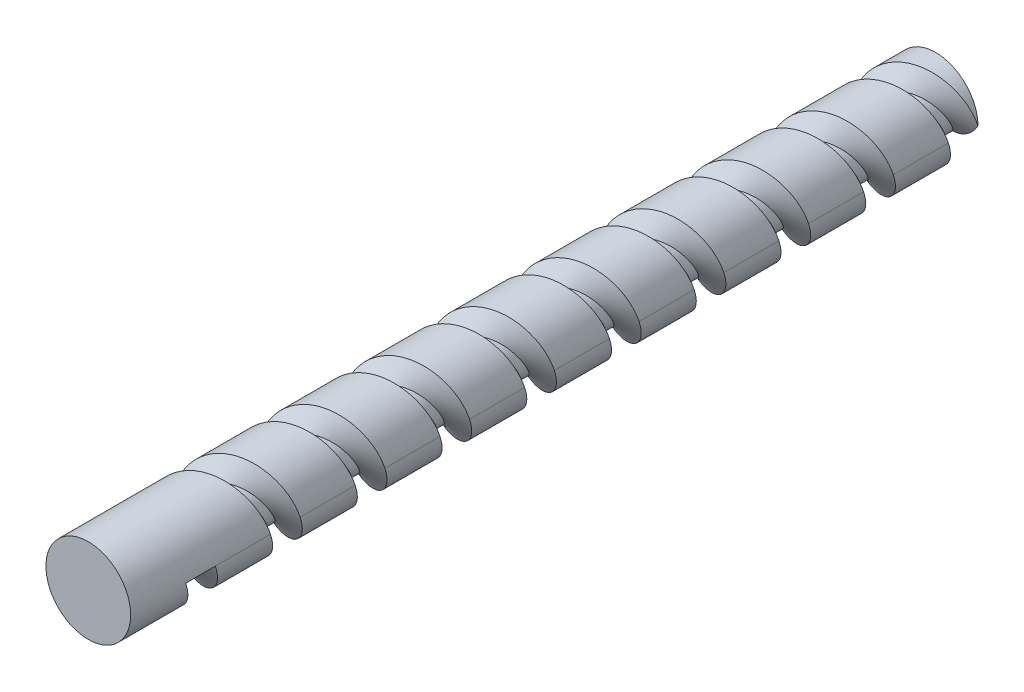
from build123d import *

# Parameters (mm, degrees)
SKETCH_1_R      = 5
EXTRUDE_1_DEPTH = 100
THREAD_4_PITCH  = 10


with BuildPart() as part:
    # ｽｹｯﾁ1 → ﾎﾞｽ - 押し出し1 (new body)
    with BuildSketch(Plane.XY):
        with Locations((7.870949576, 3.752429449)):
            Circle(SKETCH_1_R)
    extrude(amount=EXTRUDE_1_DEPTH)

    # ねじ山4: the profile of ねじ山の輪郭4 profile screwed along a right-hand helix of 10 turns, 16 arcs to a turn; built about Z, then put on its axis
    thread_4_z = Axis((0, 0, 0), (0, 0, 1))
    thread_4_corners = [(5.0003, 0, -0.000173205), (5.0003, 0, 3.500173194), (2.8349365, 0, 2.249999995), (2.8349365, 0, 1.249999995)]
    with BuildLine(mode=Mode.PRIVATE) as thread_4_profile:
        Line(thread_4_corners[0], thread_4_corners[1])
        Line(thread_4_corners[1], thread_4_corners[2])
        Line(thread_4_corners[2], thread_4_corners[3])
        Line(thread_4_corners[3], thread_4_corners[0])
    thread_4_cap = Face(thread_4_profile.wire())
    thread_4_turn_angles = [0, 11.25, 22.5, 33.75, 45, 56.25, 67.5, 78.75, 90, 101.25, 112.5, 123.75, 135, 146.25, 157.5, 168.75, 180, 191.25, 202.5, 213.75, 225, 236.25, 247.5, 258.75, 270, 281.25, 292.5, 303.75, 315, 326.25, 337.5, 348.75, 360]
    thread_4_turn_weights = [1, 0.9807852804032304, 1, 0.9807852804032304, 1, 0.9807852804032304, 1, 0.9807852804032304, 1, 0.9807852804032304, 1, 0.9807852804032304, 1, 0.9807852804032304, 1, 0.9807852804032304, 1, 0.9807852804032304, 1, 0.9807852804032304, 1, 0.9807852804032304, 1, 0.9807852804032304, 1, 0.9807852804032304, 1, 0.9807852804032304, 1, 0.9807852804032304, 1, 0.9807852804032304, 1]
    thread_4_turn_rails = [Edge.make_bspline([Vector(p[0], p[1], 0).rotate(thread_4_z, thread_4_turn_angles[k]) / thread_4_turn_weights[k] + Vector(0, 0, p[2] + THREAD_4_PITCH * thread_4_turn_angles[k] / 360) for k in range(33)], [0, 0, 0, 1, 1, 2, 2, 3, 3, 4, 4, 5, 5, 6, 6, 7, 7, 8, 8, 9, 9, 10, 10, 11, 11, 12, 12, 13, 13, 14, 14, 15, 15, 16, 16, 16], 2, thread_4_turn_weights) for p in thread_4_corners]
    thread_4_turn_sides = [Face.make_surface_from_curves(thread_4_turn_rails[p[0]], thread_4_turn_rails[p[1]]) for p in [(0, 1), (1, 2), (2, 3), (3, 0)]]
    thread_4 = Plane(origin=(7.870949576, 3.752429449, -10), x_dir=(1, 0, 0), z_dir=(0, 0, 1)) * Solid(Shell([*[p.moved(Location((0, 0, THREAD_4_PITCH * i))) for i in range(10) for p in thread_4_turn_sides], thread_4_cap, thread_4_cap.rotate(thread_4_z, 3600).moved(Location((0, 0, THREAD_4_PITCH * 3600 / 360)))]))
    add(thread_4, mode=Mode.SUBTRACT)


solid = part.part
